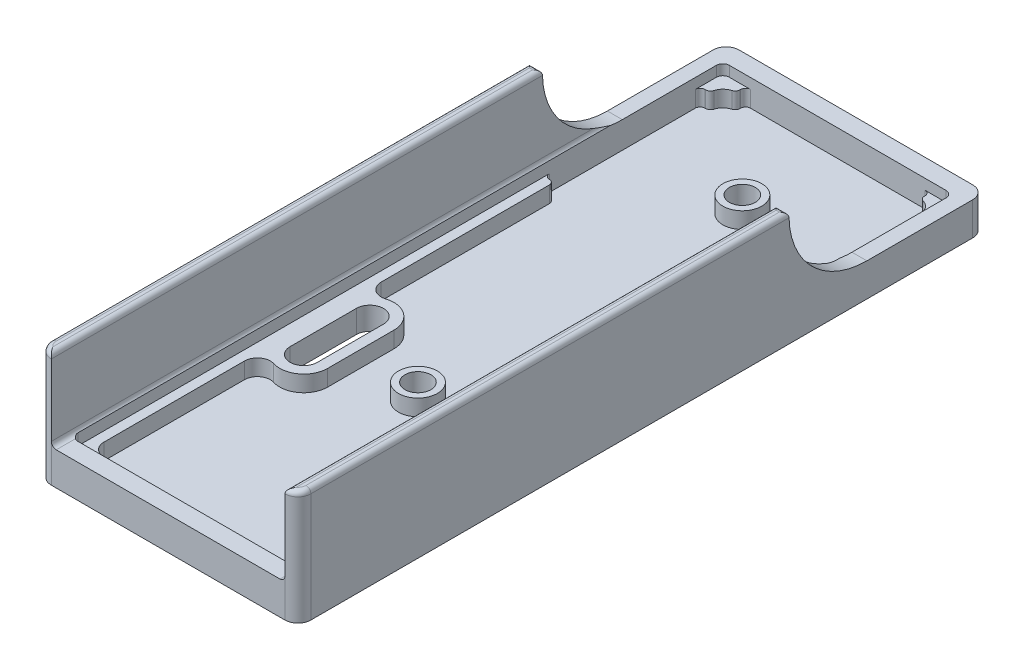
from build123d import *

# Parameters (mm, degrees)
EXTRUDE_1_DEPTH     = 5.1
CUT_EXTRUDE_1_DEPTH = 1.6
CUT_EXTRUDE_2_DEPTH = 2.5
FILLET_1_R          = 2
SKETCH_4_W          = 28.4
SKETCH_4_H          = 1.5
CUT_EXTRUDE_3_DEPTH = 2.5
SKETCH_6_R          = 2.0000000000000013
SKETCH_6_R_2        = 2.0000000000000004
CUT_EXTRUDE_4_DEPTH = 57.796214662598786
EXTRUDE_START       = 2.5
SKETCH_7_R          = 3.000000000000001
SKETCH_7_R_2        = 2.000000000000002
SKETCH_7_R_3        = 3.0000000000000004
SKETCH_7_R_4        = 2
EXTRUDE_2_DEPTH     = 2.5
FILLET_2_R          = 2
FILLET_3_R          = 0.75
EXTRUDE_START_2     = 12.5
EXTRUDE_3_DEPTH     = 12.5
FILLET_4_R          = 0.75
FILLET_START        = -20
FILLET_5_DEPTH      = 2
FILLET_START_2      = 18
FILLET_5_2_DEPTH    = 2
FILLET_START_3      = -34.697548884
FILLET_5_3_DEPTH    = 11.997548884
FILLET_START_4      = -18
FILLET_5_4_DEPTH    = 36
FILLET_6_R          = 1


with BuildPart() as part:
    # 草图1 → 凸台-拉伸1 (new body)
    with BuildSketch(Plane(origin=(0, 0, 0), x_dir=(1, 0, 0), z_dir=(0, 1, 0))):
        Polygon((-20.000000000000004, 53.00000000000001), (19.999999999999996, 53.00000000000001), (20.00000000000001, -52.99999999999999), (-19.99999999999999, -52.99999999999999), align=None)
    extrude(amount=EXTRUDE_1_DEPTH)

    # 草图2 → 切除-拉伸1 (cut)
    with BuildSketch(Plane(origin=(0, 5.1, 0), x_dir=(1, 0, 0), z_dir=(0, 1, 0))):
        Polygon((-17.700000000000006, 50.20000000000001), (17.699999999999992, 50.20000000000001), (17.700000000000006, -50.199999999999996), (-17.699999999999992, -50.199999999999996), align=None)
    extrude(amount=-CUT_EXTRUDE_1_DEPTH, mode=Mode.SUBTRACT)

    # 草图3 → 切除-拉伸2 (cut)
    with BuildSketch(Plane(origin=(0, 3.4999999999999996, 0), x_dir=(1, 0, 0), z_dir=(0, 1, 0))):
        Polygon((16.200000000000006, -48.699999999999996), (16.199999999999992, 48.70000000000001), (-16.200000000000006, 48.70000000000001), (-16.199999999999992, -48.699999999999996), align=None)
    extrude(amount=-CUT_EXTRUDE_2_DEPTH, mode=Mode.SUBTRACT)

    # 圆角1
    fillet_1_edges = [part.edges().sort_by_distance(p)[0] for p in [
        (16.200000000000006, 2.2499999999999996, 48.699999999999996),
        (-16.199999999999992, 2.2499999999999996, 48.699999999999996),
        (-16.200000000000006, 2.2499999999999996, -48.70000000000001),
        (16.199999999999992, 2.2499999999999996, -48.70000000000001),
        (20.00000000000001, 2.55, 52.99999999999999),
        (-19.99999999999999, 2.55, 52.99999999999999),
        (-20.000000000000004, 2.55, -53.00000000000001),
        (19.999999999999996, 2.55, -53.00000000000001),
    ]]
    fillet(fillet_1_edges, radius=FILLET_1_R)

    # 草图4 → 切除-拉伸3 (cut)
    with BuildSketch(Plane(origin=(0, 3.4999999999999996, 0), x_dir=(1, 0, 0), z_dir=(0, 1, 0))):
        with Locations((-4.44e-15, 49.45000000000002)):
            Rectangle(SKETCH_4_W, SKETCH_4_H)
        Polygon((-16.200000000000006, 46.7), (-17.700000000000006, 46.7), (-17.70000000000001, 22.700000000000006), (-16.200000000000003, 22.700000000000006), align=None)
        Polygon((16.199999999999992, 46.7), (17.700000000000006, 46.7), (17.700000000000006, 22.7), (16.2, 22.700000000000006), align=None)
    extrude(amount=-CUT_EXTRUDE_3_DEPTH, mode=Mode.SUBTRACT)

    # 草图6 → 切除-拉伸4 (cut, through all)
    with BuildSketch(Plane(origin=(0, 0.9999999999999996, 0), x_dir=(1, 0, 0), z_dir=(0, 1, 0))):
        with Locations(Location((2.14e-15, 35.5, 0), (0, 0, 270))):
            Circle(SKETCH_6_R)
        with Locations(Location((8.51e-15, -14.5, 0), (0, 0, 270))):
            Circle(SKETCH_6_R_2)
        with BuildLine():
            Line((-14.59999999999999, -19.599999999999998), (-14.59999999999999, -9.400000000000002))
            ThreePointArc((-14.59999999999999, -9.400000000000002), (-12.499999999999993, -7.300000000000006), (-10.399999999999997, -9.4))
            Line((-10.399999999999997, -9.4), (-10.399999999999995, -19.6))
            ThreePointArc((-10.399999999999995, -19.6), (-12.499999999999995, -21.699999999999996), (-14.59999999999999, -19.599999999999998))
        make_face()
        with BuildLine():
            Line((14.600000000000007, -19.599999999999998), (14.600000000000005, -9.399999999999999))
            ThreePointArc((14.600000000000005, -9.399999999999999), (12.500000000000009, -7.3000000000000025), (10.40000000000001, -9.4))
            Line((10.40000000000001, -9.4), (10.400000000000011, -19.599999999999998))
            ThreePointArc((10.400000000000011, -19.599999999999998), (12.500000000000009, -21.699999999999996), (14.600000000000007, -19.599999999999998))
        make_face()
    extrude(amount=-CUT_EXTRUDE_4_DEPTH, mode=Mode.SUBTRACT)

    # 草图7 → 凸台-拉伸2 (add)
    # profile 1 of 4: a face of its own
    with BuildSketch(Plane(origin=(0, 0.9999999999999996, 0), x_dir=(1, 0, 0), z_dir=(0, 1, 0)).offset(EXTRUDE_START)):
        with Locations(Location((2.14e-15, 35.5, 0), (0, 0, 270))):
            Circle(SKETCH_7_R)
        with Locations(Location((2.14e-15, 35.5, 0), (0, 0, 270))):
            Circle(SKETCH_7_R_2, mode=Mode.SUBTRACT)
    # profile 2 of 4: a face of its own
    with BuildSketch(Plane(origin=(0, 0.9999999999999996, 0), x_dir=(1, 0, 0), z_dir=(0, 1, 0)).offset(EXTRUDE_START)):
        with Locations(Location((8.51e-15, -14.5, 0), (0, 0, 270))):
            Circle(SKETCH_7_R_3)
        with Locations(Location((8.51e-15, -14.5, 0), (0, 0, 270))):
            Circle(SKETCH_7_R_4, mode=Mode.SUBTRACT)
    # profile 3 of 4: a face of its own
    with BuildSketch(Plane(origin=(0, 0.9999999999999996, 0), x_dir=(1, 0, 0), z_dir=(0, 1, 0)).offset(EXTRUDE_START)):
        with BuildLine():
            Line((-8.799999999999992, -19.600000000000005), (-8.799999999999994, -9.4))
            ThreePointArc((-8.799999999999994, -9.4), (-12.499999999999993, -5.700000000000003), (-16.199999999999992, -9.400000000000002))
            Line((-16.199999999999992, -9.400000000000002), (-16.199999999999992, -19.599999999999998))
            ThreePointArc((-16.199999999999992, -19.599999999999998), (-12.499999999999996, -23.299999999999997), (-8.799999999999992, -19.600000000000005))
        make_face()
        with BuildLine():
            Line((-14.59999999999999, -9.400000000000002), (-14.59999999999999, -19.599999999999998))
            ThreePointArc((-14.59999999999999, -19.599999999999998), (-12.499999999999995, -21.699999999999996), (-10.399999999999995, -19.6))
            Line((-10.399999999999995, -19.6), (-10.399999999999995, -9.4))
            ThreePointArc((-10.399999999999995, -9.4), (-12.499999999999993, -7.300000000000004), (-14.59999999999999, -9.400000000000002))
        make_face(mode=Mode.SUBTRACT)
    # profile 4 of 4: a face of its own
    with BuildSketch(Plane(origin=(0, 0.9999999999999996, 0), x_dir=(1, 0, 0), z_dir=(0, 1, 0)).offset(EXTRUDE_START)):
        with BuildLine():
            Line((16.200000000000006, -19.599999999999998), (16.200000000000006, -9.399999999999999))
            ThreePointArc((16.200000000000006, -9.399999999999999), (12.500000000000009, -5.700000000000005), (8.800000000000015, -9.399999999999999))
            Line((8.800000000000015, -9.399999999999999), (8.800000000000013, -19.599999999999998))
            ThreePointArc((8.800000000000013, -19.599999999999998), (12.500000000000009, -23.299999999999994), (16.200000000000006, -19.599999999999998))
        make_face()
        with BuildLine():
            Line((14.600000000000007, -19.599999999999998), (14.600000000000005, -9.399999999999999))
            ThreePointArc((14.600000000000005, -9.399999999999999), (12.500000000000009, -7.300000000000006), (10.400000000000011, -9.4))
            Line((10.400000000000011, -9.4), (10.400000000000011, -19.599999999999998))
            ThreePointArc((10.400000000000011, -19.599999999999998), (12.500000000000009, -21.699999999999996), (14.600000000000007, -19.599999999999998))
        make_face(mode=Mode.SUBTRACT)
    extrude(amount=-EXTRUDE_2_DEPTH)

    # 圆角2
    fillet_2_edges = [part.edges().sort_by_distance(p)[0] for p in [
        (-16.199999999999992, 2.2499999999999996, 9.400000000000002),
        (-16.199999999999992, 2.2499999999999996, 19.599999999999998),
        (16.200000000000006, 2.2499999999999996, 9.399999999999999),
        (16.20000000000001, 2.2499999999999996, 19.599999999999998),
    ]]
    fillet(fillet_2_edges, radius=FILLET_2_R)

    # 圆角3
    fillet_3_edges = [part.edges().sort_by_distance(p)[0] for p in [
        (16.2, 2.2499999999999996, -22.700000000000006),
        (17.700000000000006, 2.2499999999999996, -22.7),
        (-16.200000000000003, 2.2499999999999996, -22.700000000000006),
        (-17.70000000000001, 2.2499999999999996, -22.700000000000006),
        (17.700000000000006, 2.2499999999999996, -46.7),
        (14.199999999999992, 2.2499999999999996, -50.20000000000001),
        (-14.200000000000005, 2.2499999999999996, -50.20000000000001),
        (-17.700000000000006, 2.2499999999999996, -46.7),
        (-16.200000000000006, 2.2499999999999996, -46.70000000000001),
        (-14.200000000000006, 2.2499999999999996, -48.70000000000001),
        (14.199999999999992, 2.2499999999999996, -48.70000000000001),
        (16.199999999999992, 2.2499999999999996, -46.70000000000001),
    ]]
    fillet(fillet_3_edges, radius=FILLET_3_R - 0.0001)  # a hair under: the kernel refuses the full size

    # 草图9 → 凸台-拉伸3 (add)
    with BuildSketch(Plane(origin=(0, 5.1, 0), x_dir=(1, 0, 0), z_dir=(0, 1, 0)).offset(EXTRUDE_START_2)):
        with BuildLine():
            Line((-20, 22.69999999999999), (-18.000000000000007, 22.69999999999999))
            Line((-18.000000000000007, 22.69999999999999), (-17.99999999999999, -52.99999999999999))
            ThreePointArc((-17.99999999999999, -52.99999999999999), (-19.414213562373085, -52.414213562373085), (-19.99999999999999, -50.99999999999999))
            Line((-19.99999999999999, -50.99999999999999), (-20, 22.69999999999999))
        make_face()
        with BuildLine():
            Line((20.00000000000001, -50.99999999999999), (20, 22.69999999999999))
            Line((20, 22.69999999999999), (18.00000000000001, 22.69999999999999))
            Line((18.00000000000001, 22.69999999999999), (18.00000000000001, -52.99999999999999))
            ThreePointArc((18.00000000000001, -52.99999999999999), (19.414213562373106, -52.414213562373085), (20.00000000000001, -50.99999999999999))
        make_face()
    extrude(amount=-EXTRUDE_3_DEPTH)

    # 圆角4
    # the kernel refuses this fillet: 0.75 mm, written as the material it adds along each edge
    with BuildSketch(Plane(origin=(-18.000000000000007, 5.1, -22.69999999999999), x_dir=(1, 0, -2.3e-16), z_dir=(2.3e-16, 0, 1))) as fillet_4_piece_1_section:
        with BuildLine():
            CenterArc((FILLET_4_R, FILLET_4_R), FILLET_4_R, 180, 90)
            Line((0, FILLET_4_R), (0, 0))
            Line((0, 0), (FILLET_4_R, 0))
        make_face()
    fillet_4_piece_1 = extrude(amount=75.69999999999999, mode=Mode.PRIVATE)
    fillet_4_piece_1 = split(fillet_4_piece_1, bisect_by=Plane(origin=(-17.7, 5.1, -22.69999999999999), z_dir=(-1, 0, 1.4e-16)), keep=Keep.TOP, mode=Mode.PRIVATE)
    add(fillet_4_piece_1)
    with BuildSketch(Plane(origin=(-18.000000000000007, 5.1, -24.57499999999999), x_dir=(1, 0, -2.3e-16), z_dir=(2.3e-16, 0, 1))) as fillet_4_piece_2_section:
        with BuildLine():
            CenterArc((FILLET_4_R, FILLET_4_R), FILLET_4_R, 180, 90)
            Line((0, FILLET_4_R), (0, 0))
            Line((0, 0), (FILLET_4_R, 0))
        make_face()
    fillet_4_piece_2 = extrude(amount=77.57499999999999, mode=Mode.PRIVATE)
    fillet_4_piece_2 = split(fillet_4_piece_2, bisect_by=Plane(origin=(-18.000000000000007, 5.1, 50.19999999999999), z_dir=(0, 0, 1)), keep=Keep.TOP, mode=Mode.PRIVATE)
    add(fillet_4_piece_2)
    with BuildSketch(Plane(origin=(18.00000000000001, 5.1, -22.69999999999999), x_dir=(-1, 0, 0), z_dir=(0, 0, 1))) as fillet_4_piece_3_section:
        with BuildLine():
            CenterArc((FILLET_4_R, -FILLET_4_R), FILLET_4_R, 90, 90)
            Line((0, -FILLET_4_R), (0, 0))
            Line((0, 0), (FILLET_4_R, 0))
        make_face()
    fillet_4_piece_3 = extrude(amount=75.69999999999999, mode=Mode.PRIVATE)
    fillet_4_piece_3 = split(fillet_4_piece_3, bisect_by=Plane(origin=(17.7, 5.1, -22.69999999999999), z_dir=(1, 0, -1.4e-16)), keep=Keep.TOP, mode=Mode.PRIVATE)
    add(fillet_4_piece_3)
    with BuildSketch(Plane(origin=(18.00000000000001, 5.1, -24.57499999999999), x_dir=(-1, 0, 0), z_dir=(0, 0, 1))) as fillet_4_piece_4_section:
        with BuildLine():
            CenterArc((FILLET_4_R, -FILLET_4_R), FILLET_4_R, 90, 90)
            Line((0, -FILLET_4_R), (0, 0))
            Line((0, 0), (FILLET_4_R, 0))
        make_face()
    fillet_4_piece_4 = extrude(amount=77.57499999999999, mode=Mode.PRIVATE)
    fillet_4_piece_4 = split(fillet_4_piece_4, bisect_by=Plane(origin=(18.00000000000001, 5.1, 50.19999999999999), z_dir=(0, 0, 1)), keep=Keep.TOP, mode=Mode.PRIVATE)
    add(fillet_4_piece_4)
    # the kernel refuses this fillet: 0.75 mm, written as the material it takes off along each edge
    with BuildSketch(Plane(origin=(-19.99999999999999, 17.6, 50.99999999999999), x_dir=(1, 0, -1.4e-16), z_dir=(-1.4e-16, 0, -1))) as fillet_4_2_piece_1:
        with BuildLine():
            CenterArc((FILLET_4_R, FILLET_4_R), FILLET_4_R, 180, 90)
            Line((0, FILLET_4_R), (0, 0))
            Line((0, 0), (FILLET_4_R, 0))
        make_face()
    extrude(amount=75.57499999999999, mode=Mode.SUBTRACT)
    with BuildSketch(Plane(origin=(-17.99999999999999, 17.6, 50.99999999999999), x_dir=(0.8063039257097581, 0, 0.5915014618621268), z_dir=(0.5915014618621268, 0, -0.8063039257097581))) as fillet_4_2_piece_2:
        with BuildLine():
            CenterArc((2 - FILLET_4_R, FILLET_4_R), FILLET_4_R, 270, 90)
            Line((2, FILLET_4_R), (2, 0))
            Line((2, 0), (2 - FILLET_4_R, 0))
        make_face()
    revolve(axis=Axis((-17.99999999999999, 17.6, 50.99999999999999), (0, -1, 0)), revolution_arc=143.736370964023, mode=Mode.SUBTRACT)
    with BuildSketch(Plane(origin=(-18.000000000000007, 17.6, -24.57499999999999), x_dir=(-1, 0, 2.3e-16), z_dir=(2.3e-16, 0, 1)), Plane(origin=(18.00000000000001, 17.6, -24.57499999999999), x_dir=(0, -1, 0), z_dir=(0, 0, 1))) as fillet_4_2_piece_3:
        with BuildLine():
            CenterArc((FILLET_4_R, FILLET_4_R), FILLET_4_R, 180, 90)
            Line((0, FILLET_4_R), (0, 0))
            Line((0, 0), (FILLET_4_R, 0))
        make_face()
    extrude(amount=79.44999999999999, mode=Mode.SUBTRACT)
    with BuildSketch(Plane(origin=(-21.875, 17.6, -22.69999999999999), x_dir=(0, -1, 0), z_dir=(1, 0, 0))) as fillet_4_2_piece_4:
        with BuildLine():
            CenterArc((FILLET_4_R, -FILLET_4_R), FILLET_4_R, 90, 90)
            Line((0, -FILLET_4_R), (0, 0))
            Line((0, 0), (FILLET_4_R, 0))
        make_face()
    extrude(amount=5.749999999999993, mode=Mode.SUBTRACT)
    with BuildSketch(Plane(origin=(21.875, 17.6, -22.69999999999999), x_dir=(0, 0, 1), z_dir=(-1, 0, 0))) as fillet_4_2_piece_5:
        with BuildLine():
            CenterArc((FILLET_4_R, -FILLET_4_R), FILLET_4_R, 90, 90)
            Line((0, -FILLET_4_R), (0, 0))
            Line((0, 0), (FILLET_4_R, 0))
        make_face()
    extrude(amount=5.749999999999989, mode=Mode.SUBTRACT)
    with BuildSketch(Plane(origin=(18.00000000000001, 17.6, 50.99999999999999), x_dir=(-0.8063039257097581, 0, 0.5915014618621268), z_dir=(-0.5915014618621268, 0, -0.8063039257097581))) as fillet_4_2_piece_6:
        with BuildLine():
            CenterArc((2 - FILLET_4_R, -FILLET_4_R), FILLET_4_R, 0, 90)
            Line((2, -FILLET_4_R), (2, 0))
            Line((2, 0), (2 - FILLET_4_R, 0))
        make_face()
    revolve(axis=Axis((18.00000000000001, 17.6, 50.99999999999999), (0, 1, 0)), revolution_arc=143.736370964023, mode=Mode.SUBTRACT)
    with BuildSketch(Plane(origin=(20.00000000000001, 17.6, 50.99999999999999), x_dir=(-1, 0, 1.4e-16), z_dir=(-1.4e-16, 0, -1))) as fillet_4_2_piece_7:
        with BuildLine():
            CenterArc((FILLET_4_R, -FILLET_4_R), FILLET_4_R, 90, 90)
            Line((0, -FILLET_4_R), (0, 0))
            Line((0, 0), (FILLET_4_R, 0))
        make_face()
    extrude(amount=75.57499999999999, mode=Mode.SUBTRACT)

    # 圆角5: read off the stored shape, not the designer's step
    # 圆角5 outline → 圆角5 (add)
    with BuildSketch(Plane.YZ.offset(FILLET_START)):
        with BuildLine():
            ThreePointArc((5.1, -34.697548784), (8.531933432, -26.29586828), (16.864705882, -22.699855811))
            ThreePointArc((16.864705882, -22.699855811), (16.857353294, -22.699963952), (16.85, -22.7))
            Line((16.85, -22.7), (5.1, -22.7))
            Line((5.1, -22.7), (5.1, -34.697548784))
        make_face()
    extrude(amount=FILLET_5_DEPTH)

    # Fillet 5 2 outline → Fillet 5 2 (add)
    with BuildSketch(Plane.YZ.offset(FILLET_START_2)):
        with BuildLine():
            ThreePointArc((5.1, -34.697548784), (8.531933432, -26.29586828), (16.864705882, -22.699855811))
            ThreePointArc((16.864705882, -22.699855811), (16.857353294, -22.699963952), (16.85, -22.7))
            Line((16.85, -22.7), (5.1, -22.7))
            Line((5.1, -22.7), (5.1, -34.697548784))
        make_face()
    extrude(amount=FILLET_5_2_DEPTH)

    # Fillet 5 3 outline → Fillet 5 3 (add)
    with BuildSketch(Plane.XY.offset(FILLET_START_3)):
        with BuildLine():
            ThreePointArc((18, 5.85), (17.920820393, 5.514589803), (17.7, 5.25))
            Line((17.7, 5.25), (17.7, 5.1))
            Line((17.7, 5.1), (18, 5.1))
            Line((18, 5.1), (18, 5.85))
        make_face()
        with BuildLine():
            Line((-17.7, 5.1), (-17.7, 5.25))
            ThreePointArc((-17.7, 5.25), (-17.920820393, 5.514589803), (-18, 5.85))
            Line((-18, 5.85), (-18, 5.1))
            Line((-18, 5.1), (-17.7, 5.1))
        make_face()
    extrude(amount=FILLET_5_3_DEPTH)

    # Fillet 5 4 outline → Fillet 5 4 (cut)
    with BuildSketch(Plane.YZ.offset(FILLET_START_4)):
        with BuildLine():
            ThreePointArc((5.85, -30.521725511), (5.288988189, -32.57622844), (5.1, -34.697548784))
            Line((5.1, -34.697548784), (5.85, -34.697548884))
            Line((5.85, -34.697548884), (5.85, -30.521725511))
        make_face()
    extrude(amount=FILLET_5_4_DEPTH, mode=Mode.SUBTRACT)

    # 圆角6
    fillet_6_edges = [part.edges().sort_by_distance(p)[0] for p in [
        (17.700000000000003, 4.374999999999999, 50.2),
        (-17.699999999999996, 4.374999999999999, 50.2),
        (-17.700000000000006, 4.3, -50.20000000000001),
        (17.699999999999992, 4.3, -50.20000000000001),
    ]]
    fillet(fillet_6_edges, radius=FILLET_6_R)


solid = part.part
